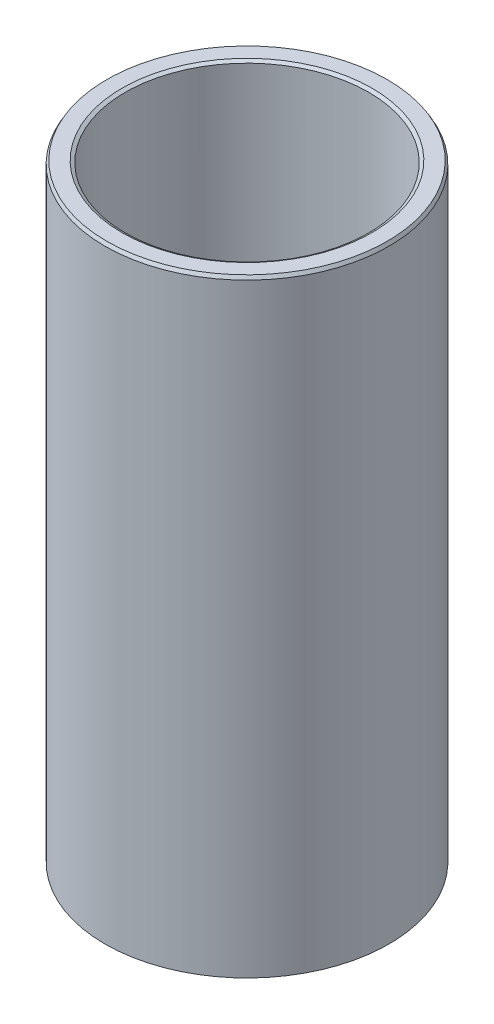
from build123d import *
from OCP.BRepFilletAPI import BRepFilletAPI_MakeChamfer

# Parameters (mm, degrees)
SKETCH1_R           = 55
BOSS_EXTRUDE1_DEPTH = 236.008714555
SKETCH2_R           = 47.15970957
CUT_EXTRUDE1_DEPTH  = 249.49570086
CHAMFER1_SIZE       = 1.269506722
CHAMFER1_SIZE2      = 0.732950048


with BuildPart() as part:
    # Sketch1 → Boss-Extrude1 (new body)
    with BuildSketch(Plane(origin=(0, 0, 0), x_dir=(1, 0, 0), z_dir=(0, 1, 0))):
        Circle(SKETCH1_R)
    extrude(amount=BOSS_EXTRUDE1_DEPTH)

    # Sketch2 → Cut-Extrude1 (cut, through all)
    with BuildSketch(Plane(origin=(0, 0, 0), x_dir=(1, 0, 0), z_dir=(0, 1, 0))):
        Circle(SKETCH2_R)
    extrude(amount=CUT_EXTRUDE1_DEPTH, mode=Mode.SUBTRACT)

    # Chamfer1: one chamfer whose edges measure the first distance from different faces: ONE call of the kernel's chamfer builder (chamfer() names one face for all edges)
    chamfer1_edges_1 = [part.edges().sort_by_distance(p)[0] for p in [
        (-47.15970957, 236.008714555, 0),
    ]]
    chamfer1_side_1 = [part.faces().sort_by_distance(p)[0] for p in [
        (-53.444365081, 236.008714555, 0),
    ]]
    chamfer1_edges_2 = [part.edges().sort_by_distance(p)[0] for p in [
        (-47.15970957, 0, 0),
    ]]
    chamfer1_side_2 = [part.faces().sort_by_distance(p)[0] for p in [
        (-47.15970957, 118.004357277, 0),
    ]]
    chamfer1_edges_3 = [part.edges().sort_by_distance(p)[0] for p in [
        (-55, 0, 0),
    ]]
    chamfer1_side_3 = [part.faces().sort_by_distance(p)[0] for p in [
        (-53.444365081, 0, 0),
    ]]
    chamfer1_edges_4 = [part.edges().sort_by_distance(p)[0] for p in [
        (-55, 236.008714555, 0),
    ]]
    chamfer1_side_4 = [part.faces().sort_by_distance(p)[0] for p in [
        (-55, 118.004357277, 0),
    ]]
    chamfer1 = BRepFilletAPI_MakeChamfer(part.part.solid().wrapped)
    for e in chamfer1_edges_1:
        chamfer1.Add(CHAMFER1_SIZE, CHAMFER1_SIZE2, e.wrapped, chamfer1_side_1[0].wrapped)  # the first distance lies on this face
    for e in chamfer1_edges_2:
        chamfer1.Add(CHAMFER1_SIZE, CHAMFER1_SIZE2, e.wrapped, chamfer1_side_2[0].wrapped)  # the first distance lies on this face
    for e in chamfer1_edges_3:
        chamfer1.Add(CHAMFER1_SIZE, CHAMFER1_SIZE2, e.wrapped, chamfer1_side_3[0].wrapped)  # the first distance lies on this face
    for e in chamfer1_edges_4:
        chamfer1.Add(CHAMFER1_SIZE, CHAMFER1_SIZE2, e.wrapped, chamfer1_side_4[0].wrapped)  # the first distance lies on this face
    add(Compound.cast(chamfer1.Shape()), mode=Mode.REPLACE)


solid = part.part
